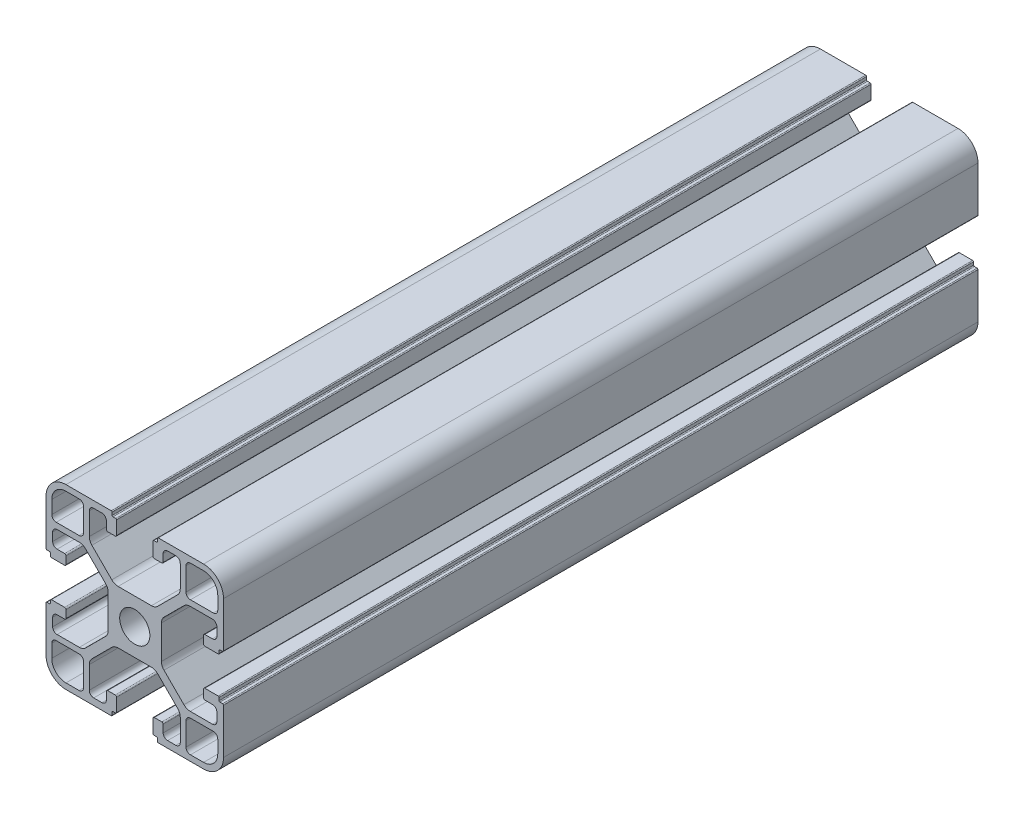
from build123d import *

# Parameters (mm, degrees)
SKETCH2_R           = 3.4
BOSS_EXTRUDE1_DEPTH = 170
SKETCH4_R           = 2.5
CUT_EXTRUDE1_DEPTH  = 180.164728672


with BuildPart() as part:
    # Sketch2 → Boss-Extrude1 (new body)
    with BuildSketch(Plane.XY):
        with BuildLine():
            Line((4.5, 0), (14.7, 0))
            ThreePointArc((14.7, 0), (14.841421356, 0.058578644), (14.9, 0.2))
            Line((14.9, 0.2), (14.9, 0.8))
            ThreePointArc((14.9, 0.8), (14.958578644, 0.941421356), (15.1, 1))
            Line((15.1, 1), (15.7, 1))
            ThreePointArc((15.7, 1), (15.841421356, 1.058578644), (15.9, 1.2))
            Line((15.9, 1.2), (15.9, 4.2))
            ThreePointArc((15.9, 4.2), (15.812132034, 4.412132034), (15.6, 4.5))
            Line((15.6, 4.5), (13.9, 4.5))
            ThreePointArc((13.9, 4.5), (13.687867966, 4.412132034), (13.6, 4.2))
            Line((13.6, 4.2), (13.6, 2.5))
            ThreePointArc((13.6, 2.5), (13.307106781, 1.792893219), (12.6, 1.5))
            Line((12.6, 1.5), (10.75, 1.5))
            ThreePointArc((10.75, 1.5), (10.042893219, 1.792893219), (9.75, 2.5))
            Line((9.75, 2.5), (9.75, 7.507359313))
            ThreePointArc((9.75, 7.507359313), (9.902240935, 8.272726178), (10.335786438, 8.921572875))
            Line((10.335786438, 8.921572875), (14.828427125, 13.414213562))
            ThreePointArc((14.828427125, 13.414213562), (15.477273822, 13.847759065), (16.242640687, 14))
            Line((16.242640687, 14), (23.757359313, 14))
            ThreePointArc((23.757359313, 14), (24.522726178, 13.847759065), (25.171572875, 13.414213562))
            Line((25.171572875, 13.414213562), (29.664213562, 8.921572875))
            ThreePointArc((29.664213562, 8.921572875), (30.097759065, 8.272726178), (30.25, 7.507359313))
            Line((30.25, 7.507359313), (30.25, 2.5))
            ThreePointArc((30.25, 2.5), (29.957106781, 1.792893219), (29.25, 1.5))
            Line((29.25, 1.5), (27.4, 1.5))
            ThreePointArc((27.4, 1.5), (26.692893219, 1.792893219), (26.4, 2.5))
            Line((26.4, 2.5), (26.4, 4.2))
            ThreePointArc((26.4, 4.2), (26.312132034, 4.412132034), (26.1, 4.5))
            Line((26.1, 4.5), (24.4, 4.5))
            ThreePointArc((24.4, 4.5), (24.187867966, 4.412132034), (24.1, 4.2))
            Line((24.1, 4.2), (24.1, 1.2))
            ThreePointArc((24.1, 1.2), (24.158578644, 1.058578644), (24.3, 1))
            Line((24.3, 1), (24.9, 1))
            ThreePointArc((24.9, 1), (25.041421356, 0.941421356), (25.1, 0.8))
            Line((25.1, 0.8), (25.1, 0.2))
            ThreePointArc((25.1, 0.2), (25.158578644, 0.058578644), (25.3, 0))
            Line((25.3, 0), (35.5, 0))
            ThreePointArc((35.5, 0), (38.681980515, 1.318019485), (40, 4.5))
            Line((40, 4.5), (40, 14.7))
            ThreePointArc((40, 14.7), (39.941421356, 14.841421356), (39.8, 14.9))
            Line((39.8, 14.9), (39.2, 14.9))
            ThreePointArc((39.2, 14.9), (39.058578644, 14.958578644), (39, 15.1))
            Line((39, 15.1), (39, 15.7))
            ThreePointArc((39, 15.7), (38.941421356, 15.841421356), (38.8, 15.9))
            Line((38.8, 15.9), (35.8, 15.9))
            ThreePointArc((35.8, 15.9), (35.587867966, 15.812132034), (35.5, 15.6))
            Line((35.5, 15.6), (35.5, 13.9))
            ThreePointArc((35.5, 13.9), (35.587867966, 13.687867966), (35.8, 13.6))
            Line((35.8, 13.6), (37.5, 13.6))
            ThreePointArc((37.5, 13.6), (38.207106781, 13.307106781), (38.5, 12.6))
            Line((38.5, 12.6), (38.5, 10.75))
            ThreePointArc((38.5, 10.75), (38.207106781, 10.042893219), (37.5, 9.75))
            Line((37.5, 9.75), (32.492640687, 9.75))
            ThreePointArc((32.492640687, 9.75), (31.727273822, 9.902240935), (31.078427125, 10.335786438))
            Line((31.078427125, 10.335786438), (26.585786438, 14.828427125))
            ThreePointArc((26.585786438, 14.828427125), (26.152240935, 15.477273822), (26, 16.242640687))
            Line((26, 16.242640687), (26, 23.757359313))
            ThreePointArc((26, 23.757359313), (26.152240935, 24.522726178), (26.585786438, 25.171572875))
            Line((26.585786438, 25.171572875), (31.078427125, 29.664213562))
            ThreePointArc((31.078427125, 29.664213562), (31.727273822, 30.097759065), (32.492640687, 30.25))
            Line((32.492640687, 30.25), (37.5, 30.25))
            ThreePointArc((37.5, 30.25), (38.207106781, 29.957106781), (38.5, 29.25))
            Line((38.5, 29.25), (38.5, 27.4))
            ThreePointArc((38.5, 27.4), (38.207106781, 26.692893219), (37.5, 26.4))
            Line((37.5, 26.4), (35.8, 26.4))
            ThreePointArc((35.8, 26.4), (35.587867966, 26.312132034), (35.5, 26.1))
            Line((35.5, 26.1), (35.5, 24.4))
            ThreePointArc((35.5, 24.4), (35.587867966, 24.187867966), (35.8, 24.1))
            Line((35.8, 24.1), (38.8, 24.1))
            ThreePointArc((38.8, 24.1), (38.941421356, 24.158578644), (39, 24.3))
            Line((39, 24.3), (39, 24.9))
            ThreePointArc((39, 24.9), (39.058578644, 25.041421356), (39.2, 25.1))
            Line((39.2, 25.1), (39.8, 25.1))
            ThreePointArc((39.8, 25.1), (39.941421356, 25.158578644), (40, 25.3))
            Line((40, 25.3), (40, 35.5))
            ThreePointArc((40, 35.5), (38.681980515, 38.681980515), (35.5, 40))
            Line((35.5, 40), (25.3, 40))
            ThreePointArc((25.3, 40), (25.158578644, 39.941421356), (25.1, 39.8))
            Line((25.1, 39.8), (25.1, 39.2))
            ThreePointArc((25.1, 39.2), (25.041421356, 39.058578644), (24.9, 39))
            Line((24.9, 39), (24.3, 39))
            ThreePointArc((24.3, 39), (24.158578644, 38.941421356), (24.1, 38.8))
            Line((24.1, 38.8), (24.1, 35.8))
            ThreePointArc((24.1, 35.8), (24.187867966, 35.587867966), (24.4, 35.5))
            Line((24.4, 35.5), (26.1, 35.5))
            ThreePointArc((26.1, 35.5), (26.312132034, 35.587867966), (26.4, 35.8))
            Line((26.4, 35.8), (26.4, 37.5))
            ThreePointArc((26.4, 37.5), (26.692893219, 38.207106781), (27.4, 38.5))
            Line((27.4, 38.5), (29.25, 38.5))
            ThreePointArc((29.25, 38.5), (29.957106781, 38.207106781), (30.25, 37.5))
            Line((30.25, 37.5), (30.25, 32.492640687))
            ThreePointArc((30.25, 32.492640687), (30.097759065, 31.727273822), (29.664213562, 31.078427125))
            Line((29.664213562, 31.078427125), (25.171572875, 26.585786438))
            ThreePointArc((25.171572875, 26.585786438), (24.522726178, 26.152240935), (23.757359313, 26))
            Line((23.757359313, 26), (16.242640687, 26))
            ThreePointArc((16.242640687, 26), (15.477273822, 26.152240935), (14.828427125, 26.585786438))
            Line((14.828427125, 26.585786438), (10.335786438, 31.078427125))
            ThreePointArc((10.335786438, 31.078427125), (9.902240935, 31.727273822), (9.75, 32.492640687))
            Line((9.75, 32.492640687), (9.75, 37.5))
            ThreePointArc((9.75, 37.5), (10.042893219, 38.207106781), (10.75, 38.5))
            Line((10.75, 38.5), (12.6, 38.5))
            ThreePointArc((12.6, 38.5), (13.307106781, 38.207106781), (13.6, 37.5))
            Line((13.6, 37.5), (13.6, 35.8))
            ThreePointArc((13.6, 35.8), (13.687867966, 35.587867966), (13.9, 35.5))
            Line((13.9, 35.5), (15.6, 35.5))
            ThreePointArc((15.6, 35.5), (15.812132034, 35.587867966), (15.9, 35.8))
            Line((15.9, 35.8), (15.9, 38.8))
            ThreePointArc((15.9, 38.8), (15.841421356, 38.941421356), (15.7, 39))
            Line((15.7, 39), (15.1, 39))
            ThreePointArc((15.1, 39), (14.958578644, 39.058578644), (14.9, 39.2))
            Line((14.9, 39.2), (14.9, 39.8))
            ThreePointArc((14.9, 39.8), (14.841421356, 39.941421356), (14.7, 40))
            Line((14.7, 40), (4.5, 40))
            ThreePointArc((4.5, 40), (1.318019485, 38.681980515), (0, 35.5))
            Line((0, 35.5), (0, 25.3))
            ThreePointArc((0, 25.3), (0.058578644, 25.158578644), (0.2, 25.1))
            Line((0.2, 25.1), (0.8, 25.1))
            ThreePointArc((0.8, 25.1), (0.941421356, 25.041421356), (1, 24.9))
            Line((1, 24.9), (1, 24.3))
            ThreePointArc((1, 24.3), (1.058578644, 24.158578644), (1.2, 24.1))
            Line((1.2, 24.1), (4.2, 24.1))
            ThreePointArc((4.2, 24.1), (4.412132034, 24.187867966), (4.5, 24.4))
            Line((4.5, 24.4), (4.5, 26.1))
            ThreePointArc((4.5, 26.1), (4.412132034, 26.312132034), (4.2, 26.4))
            Line((4.2, 26.4), (2.5, 26.4))
            ThreePointArc((2.5, 26.4), (1.792893219, 26.692893219), (1.5, 27.4))
            Line((1.5, 27.4), (1.5, 29.25))
            ThreePointArc((1.5, 29.25), (1.792893219, 29.957106781), (2.5, 30.25))
            Line((2.5, 30.25), (7.507359313, 30.25))
            ThreePointArc((7.507359313, 30.25), (8.272726178, 30.097759065), (8.921572875, 29.664213562))
            Line((8.921572875, 29.664213562), (13.414213562, 25.171572875))
            ThreePointArc((13.414213562, 25.171572875), (13.847759065, 24.522726178), (14, 23.757359313))
            Line((14, 23.757359313), (14, 16.242640687))
            ThreePointArc((14, 16.242640687), (13.847759065, 15.477273822), (13.414213562, 14.828427125))
            Line((13.414213562, 14.828427125), (8.921572875, 10.335786438))
            ThreePointArc((8.921572875, 10.335786438), (8.272726178, 9.902240935), (7.507359313, 9.75))
            Line((7.507359313, 9.75), (2.5, 9.75))
            ThreePointArc((2.5, 9.75), (1.792893219, 10.042893219), (1.5, 10.75))
            Line((1.5, 10.75), (1.5, 12.6))
            ThreePointArc((1.5, 12.6), (1.792893219, 13.307106781), (2.5, 13.6))
            Line((2.5, 13.6), (4.2, 13.6))
            ThreePointArc((4.2, 13.6), (4.412132034, 13.687867966), (4.5, 13.9))
            Line((4.5, 13.9), (4.5, 15.6))
            ThreePointArc((4.5, 15.6), (4.412132034, 15.812132034), (4.2, 15.9))
            Line((4.2, 15.9), (1.2, 15.9))
            ThreePointArc((1.2, 15.9), (1.058578644, 15.841421356), (1, 15.7))
            Line((1, 15.7), (1, 15.1))
            ThreePointArc((1, 15.1), (0.941421356, 14.958578644), (0.8, 14.9))
            Line((0.8, 14.9), (0.2, 14.9))
            ThreePointArc((0.2, 14.9), (0.058578644, 14.841421356), (0, 14.7))
            Line((0, 14.7), (0, 4.5))
            ThreePointArc((0, 4.5), (1.318019485, 1.318019485), (4.5, 0))
        make_face()
        with Locations((20, 20)):
            Circle(SKETCH2_R, mode=Mode.SUBTRACT)
        with BuildLine():
            Line((31.55, 37.7), (31.55, 32.55))
            ThreePointArc((31.55, 32.55), (31.842893219, 31.842893219), (32.55, 31.55))
            Line((32.55, 31.55), (37.7, 31.55))
            ThreePointArc((37.7, 31.55), (38.407106781, 31.842893219), (38.7, 32.55))
            Line((38.7, 32.55), (38.7, 35.5))
            ThreePointArc((38.7, 35.5), (37.7627417, 37.7627417), (35.5, 38.7))
            Line((35.5, 38.7), (32.55, 38.7))
            ThreePointArc((32.55, 38.7), (31.842893219, 38.407106781), (31.55, 37.7))
        make_face(mode=Mode.SUBTRACT)
        with BuildLine():
            Line((1.3, 35.5), (1.3, 32.55))
            ThreePointArc((1.3, 32.55), (1.592893219, 31.842893219), (2.3, 31.55))
            Line((2.3, 31.55), (7.45, 31.55))
            ThreePointArc((7.45, 31.55), (8.157106781, 31.842893219), (8.45, 32.55))
            Line((8.45, 32.55), (8.45, 37.7))
            ThreePointArc((8.45, 37.7), (8.157106781, 38.407106781), (7.45, 38.7))
            Line((7.45, 38.7), (4.5, 38.7))
            ThreePointArc((4.5, 38.7), (2.2372583, 37.7627417), (1.3, 35.5))
        make_face(mode=Mode.SUBTRACT)
        with BuildLine():
            Line((1.3, 7.45), (1.3, 4.5))
            ThreePointArc((1.3, 4.5), (2.2372583, 2.2372583), (4.5, 1.3))
            Line((4.5, 1.3), (7.45, 1.3))
            ThreePointArc((7.45, 1.3), (8.157106781, 1.592893219), (8.45, 2.3))
            Line((8.45, 2.3), (8.45, 7.45))
            ThreePointArc((8.45, 7.45), (8.157106781, 8.157106781), (7.45, 8.45))
            Line((7.45, 8.45), (2.3, 8.45))
            ThreePointArc((2.3, 8.45), (1.592893219, 8.157106781), (1.3, 7.45))
        make_face(mode=Mode.SUBTRACT)
        with BuildLine():
            Line((31.55, 7.45), (31.55, 2.3))
            ThreePointArc((31.55, 2.3), (31.842893219, 1.592893219), (32.55, 1.3))
            Line((32.55, 1.3), (35.5, 1.3))
            ThreePointArc((35.5, 1.3), (37.7627417, 2.2372583), (38.7, 4.5))
            Line((38.7, 4.5), (38.7, 7.45))
            ThreePointArc((38.7, 7.45), (38.407106781, 8.157106781), (37.7, 8.45))
            Line((37.7, 8.45), (32.55, 8.45))
            ThreePointArc((32.55, 8.45), (31.842893219, 8.157106781), (31.55, 7.45))
        make_face(mode=Mode.SUBTRACT)
    extrude(amount=BOSS_EXTRUDE1_DEPTH)

    # Sketch4 → Cut-Extrude1 (cut, through all)
    with BuildSketch(Plane.ZY):
        with Locations((15, 20)):
            Circle(SKETCH4_R)
        with Locations((68, 20)):
            Circle(SKETCH4_R)
    extrude(amount=-CUT_EXTRUDE1_DEPTH, mode=Mode.SUBTRACT)


solid = part.part
